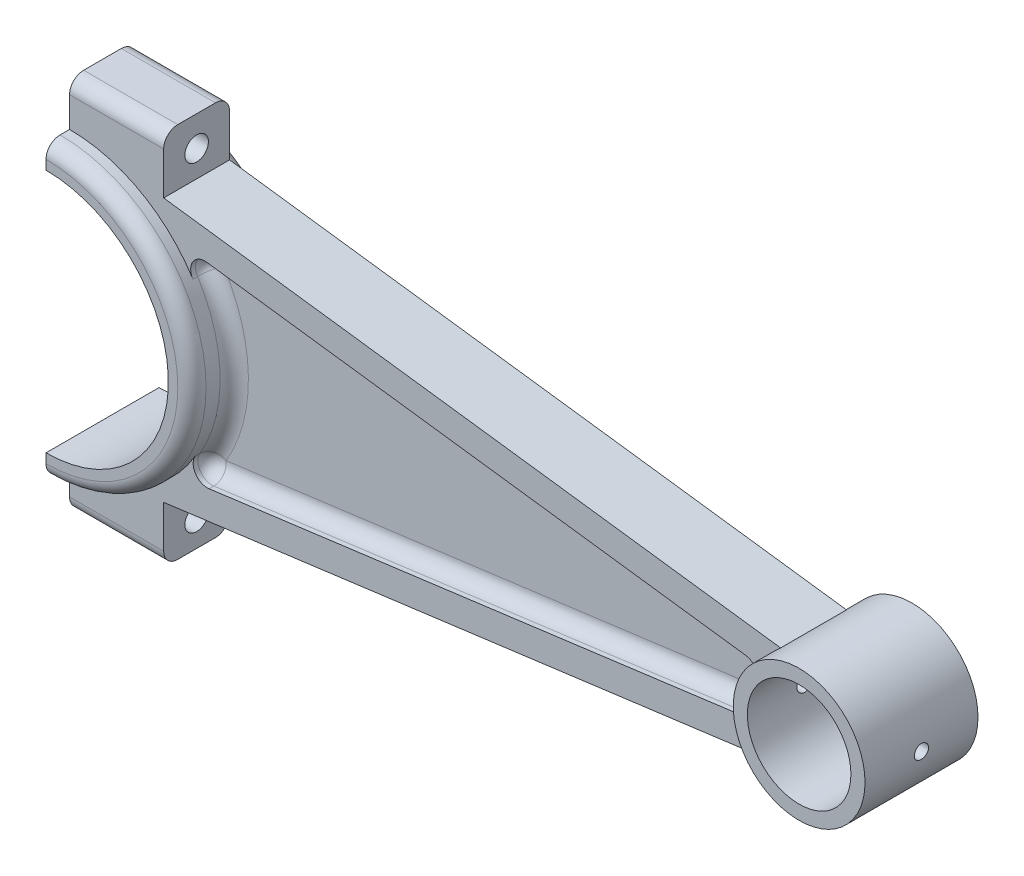
from build123d import *
from build123d.topology import SkipClean

# Parameters (mm, degrees)
EXTRUDE_1_DEPTH          = 12
SKETCH_2_W               = 174
SKETCH_2_H               = 80
EXTRUDE_2_DEPTH          = 7
CUT_EXTRUDE_1_DEPTH      = 180.0296327
CUT_EXTRUDE_1_DEPTH_BACK = 180.0296327
SKETCH_5_R               = 14
EXTRUDE_5_DEPTH          = 12
CUT_EXTRUDE_2_DEPTH      = 181.23213316
CUT_EXTRUDE_2_DEPTH_BACK = 181.23213316
SKETCH_11_R              = 11
CUT_EXTRUDE_3_DEPTH      = 180.029667439
CUT_EXTRUDE_3_DEPTH_BACK = 180.029667439
CUT_EXTRUDE_4_DEPTH      = 180.029667439
CUT_EXTRUDE_4_DEPTH_BACK = 180.029667439
CUT_EXTRUDE_6_DEPTH      = 180.029667439
CUT_EXTRUDE_6_DEPTH_BACK = 180.029667439
EXTRUDE_6_DEPTH          = 3
CUT_EXTRUDE_7_DEPTH      = 180.029667439
CUT_EXTRUDE_7_DEPTH_BACK = 180.029667439
SKETCH_19_R              = 2.5
CUT_EXTRUDE_8_DEPTH      = 160.660954506
CUT_EXTRUDE_8_DEPTH_BACK = 160.660954506
SKETCH_20_R              = 2.5
CUT_EXTRUDE_9_DEPTH      = 180.029667439
CUT_EXTRUDE_9_DEPTH_BACK = 180.029667439
SKETCH_21_R              = 1.5
FILLET_1_R               = 3
FILLET_2_R               = 3
FILLET_3_R               = 3
FILLET_START             = -7
FILLET_4_DEPTH           = 14
FILLET_5_R               = 3
FILLET_6_R               = 3


with BuildPart() as part:
    # 草图1 → 凸台-拉伸1 (new, symmetric)
    with BuildSketch(Plane.XY):
        with BuildLine():
            Line((0, 31), (0, -31))
            ThreePointArc((0, -31), (31, 0), (0, 31))
        make_face()
    extrude(amount=EXTRUDE_1_DEPTH, both=True)

    # 草图2 → 凸台-拉伸2 (add, symmetric)
    with BuildSketch(Plane.XY):
        with Locations((87, 0.393184881)):
            Rectangle(SKETCH_2_W, SKETCH_2_H)
    extrude(amount=EXTRUDE_2_DEPTH, both=True)

    # 草图4 → 切除-拉伸1 (cut, two sides: drawn at the far end of the back side and taken through both)
    with BuildSketch(Plane.XY.offset(-CUT_EXTRUDE_1_DEPTH_BACK)):
        with BuildLine():
            Line((0, 26), (0, -26))
            ThreePointArc((0, -26), (26, 0), (0, 26))
        make_face()
    extrude(amount=CUT_EXTRUDE_1_DEPTH + CUT_EXTRUDE_1_DEPTH_BACK, mode=Mode.SUBTRACT)

    # 草图5 → 凸台-拉伸5 (add, symmetric)
    with BuildSketch(Plane.XY):
        with Locations((160.000035743, 0.361549397)):
            Circle(SKETCH_5_R)
    extrude(amount=EXTRUDE_5_DEPTH, both=True)

    # 草图11 → 切除-拉伸2 (cut, two sides: drawn at the far end of the back side and taken through both)
    with BuildSketch(Plane.XY.offset(12).offset(-CUT_EXTRUDE_2_DEPTH_BACK)):
        with Locations((160.000035743, 0.361549397)):
            Circle(SKETCH_11_R)
    extrude(amount=CUT_EXTRUDE_2_DEPTH + CUT_EXTRUDE_2_DEPTH_BACK, mode=Mode.SUBTRACT)

    # 草图12 → 切除-拉伸3 (cut, two sides: drawn at the far end of the back side and taken through both)
    with BuildSketch(Plane.XY.offset(-CUT_EXTRUDE_3_DEPTH_BACK)):
        with BuildLine():
            ThreePointArc((150.998055783, -10.360593896), (165.91494405, -12.327574282), (174.000035743, 0.361549397))
            Line((174.000035743, 0.361549397), (174, -39.606815119))
            Line((174, -39.606815119), (20, -39.606815119))
            Line((20, -39.606815119), (20, -27.606815119))
            Line((20, -27.606815119), (150.998055783, -10.360593896))
        make_face()
    extrude(amount=CUT_EXTRUDE_3_DEPTH + CUT_EXTRUDE_3_DEPTH_BACK, mode=Mode.SUBTRACT)

    # 草图13 → 切除-拉伸4 (cut, two sides: drawn at the far end of the back side and taken through both)
    with BuildSketch(Plane.XY.offset(-CUT_EXTRUDE_4_DEPTH_BACK)):
        with BuildLine():
            Line((20, 28.393184881), (151.063550898, 11.138341063))
            ThreePointArc((151.063550898, 11.138341063), (165.939252971, 13.039313345), (174, 0.393184881))
            Line((174, 0.393184881), (174, 40.393184881))
            Line((174, 40.393184881), (20, 40.393184881))
            Line((20, 40.393184881), (20, 28.393184881))
        make_face()
    extrude(amount=CUT_EXTRUDE_4_DEPTH + CUT_EXTRUDE_4_DEPTH_BACK, mode=Mode.SUBTRACT)

    # 草图14 → 切除-拉伸6 (cut, two sides: drawn at the far end of the back side and taken through both)
    with SkipClean():  # the faces are left unmerged after this step: merging them gives an invalid solid
        with BuildSketch(Plane.XY.offset(-CUT_EXTRUDE_6_DEPTH_BACK)):
            with BuildLine():
                Line((147.02443227, 5.618327355), (21.724512141, 22.114374787))
                ThreePointArc((21.724512141, 22.114374787), (30.993578045, 0.630967477), (22.606548392, -21.21188275))
                Line((22.606548392, -21.21188275), (147.000250841, -4.835141138))
                ThreePointArc((147.000250841, -4.835141138), (146.000073201, 0.393934732), (147.02443227, 5.618327355))
            make_face()
        extrude(amount=CUT_EXTRUDE_6_DEPTH + CUT_EXTRUDE_6_DEPTH_BACK, mode=Mode.SUBTRACT)
    add(part.part.scale(1), mode=Mode.REPLACE)  # the faces are merged on a copy

    # 草图17 → 凸台-拉伸6 (add, symmetric)
    with BuildSketch(Plane.XY):
        with BuildLine():
            ThreePointArc((22.606548392, -21.21188275), (30.993578045, 0.630967477), (21.724512141, 22.114374787))
            Line((21.724512141, 22.114374787), (147.02443227, 5.618327355))
            ThreePointArc((147.02443227, 5.618327355), (146.000073201, 0.393934732), (147.000250841, -4.835141138))
            Line((147.000250841, -4.835141138), (22.606548392, -21.21188275))
        make_face()
    extrude(amount=EXTRUDE_6_DEPTH, both=True)

    # 草图19 → 切除-拉伸7 (cut, two sides: drawn at the far end of the back side and taken through both)
    with BuildSketch(Plane(origin=(0, 0, 0), x_dir=(0, 0, -1), z_dir=(1, 0, 0)).offset(-CUT_EXTRUDE_7_DEPTH_BACK)):
        with Locations((0, 34)):
            Circle(SKETCH_19_R)
    extrude(amount=CUT_EXTRUDE_7_DEPTH + CUT_EXTRUDE_7_DEPTH_BACK, mode=Mode.SUBTRACT)

    # 草图20 → 切除-拉伸8 (cut, two sides: drawn at the far end of the back side and taken through both)
    with BuildSketch(Plane(origin=(20, 0, 0), x_dir=(0, 0, -1), z_dir=(1, 0, 0)).offset(-CUT_EXTRUDE_8_DEPTH_BACK)):
        with Locations((0, -34)):
            Circle(SKETCH_20_R)
    extrude(amount=CUT_EXTRUDE_8_DEPTH + CUT_EXTRUDE_8_DEPTH_BACK, mode=Mode.SUBTRACT)

    # 草图21 → 切除-拉伸9 (cut, two sides: drawn at the far end of the back side and taken through both)
    with BuildSketch(Plane(origin=(0, 0, 0), x_dir=(0, 0, -1), z_dir=(1, 0, 0)).offset(-CUT_EXTRUDE_9_DEPTH_BACK)):
        Circle(SKETCH_21_R)
    extrude(amount=CUT_EXTRUDE_9_DEPTH + CUT_EXTRUDE_9_DEPTH_BACK, mode=Mode.SUBTRACT)

    # 圆角1
    fillet_1_edges = [part.edges().sort_by_distance(p)[0] for p in [
        (10, -39.606815119, 7),
        (10, -39.606815119, -7),
        (10, 40.393184881, -7),
        (10, 40.393184881, 7),
    ]]
    fillet(fillet_1_edges, radius=FILLET_1_R)

    # 圆角2
    fillet_2_edges = [part.edges().sort_by_distance(p)[0] for p in [
        (31, 0, -12),
        (31, 0, 12),
    ]]
    fillet(fillet_2_edges, radius=FILLET_2_R)

    # 圆角3
    fillet_3_edges = [part.edges().sort_by_distance(p)[0] for p in [
        (22.606548392, -21.21188275, -5),
        (21.724512141, 22.114374787, -5),
        (21.724512141, 22.114374787, 5),
        (22.606548392, -21.21188275, 5),
    ]]
    fillet(fillet_3_edges, radius=FILLET_3_R)

    # 圆角4: read off the stored shape, not the designer's step
    # 圆角4 outline → 圆角4 (add)
    with SkipClean():  # the faces are left unmerged after this step: merging them gives an invalid solid
        with BuildSketch(Plane.XY.offset(FILLET_START)):
            with BuildLine():
                Line((147.02443227, 5.618327355), (143.612514441, 6.067514858))
                ThreePointArc((143.612514441, 6.067514858), (145.628554658, 4.882976839), (146.18195349, 2.611127766))
                ThreePointArc((146.18195349, 2.611127766), (146.519078394, 4.138292564), (147.02443227, 5.618327355))
            make_face()
            with BuildLine():
                ThreePointArc((147.000250841, -4.835141138), (146.503487598, -3.359094119), (146.173743348, -1.837004355))
                ThreePointArc((146.173743348, -1.837004355), (145.615277586, -4.102360388), (143.602544983, -5.2824576))
                Line((143.602544983, -5.2824576), (147.000250841, -4.835141138))
            make_face()
        extrude(amount=FILLET_4_DEPTH)

    # 圆角5
    fillet_5_edges = [part.edges().sort_by_distance(p)[0] for p in [
        (30.99663104, 0.457016597, 3),
        (86.372516009, 13.603303614, 3),
        (26.213672417, 19.781211811, 3),
        (26.760813079, -18.963065606, 3),
        (146.000059591, 0.387389859, 3),
        (86.629049021, -12.78316064, 3),
        (145.628554658, 4.882976839, 3),
        (145.615277586, -4.102360388, 3),
    ]]
    fillet(fillet_5_edges, radius=FILLET_5_R)

    # 圆角6
    fillet_6_edges = [part.edges().sort_by_distance(p)[0] for p in [
        (30.99663104, 0.457016597, -3),
        (86.372516009, 13.603303614, -3),
        (26.760813079, -18.963065606, -3),
        (26.213672417, 19.781211811, -3),
        (146.000059591, 0.387389859, -3),
        (86.629049021, -12.78316064, -3),
        (145.615277586, -4.102360388, -3),
        (145.628554658, 4.882976839, -3),
    ]]
    fillet(fillet_6_edges, radius=FILLET_6_R)


solid = part.part
